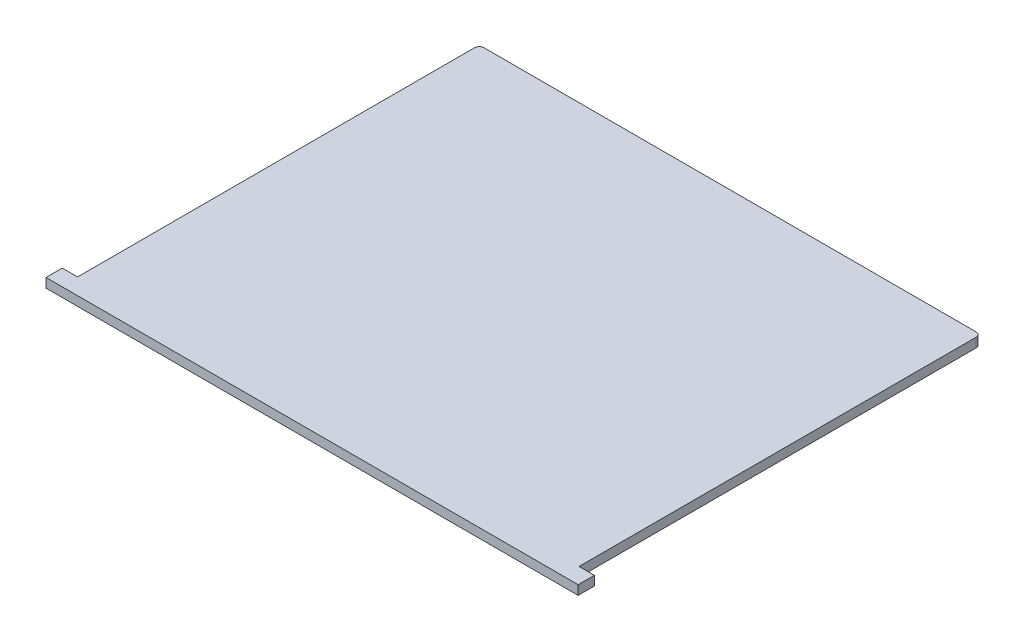
from build123d import *

# Parameters (mm, degrees)
BOSS_EXTRUDE1_DEPTH = 1
FILLET1_R           = 0.5


with BuildPart() as part:
    # Sketch1 → Boss-Extrude1 (new body)
    with BuildSketch(Plane(origin=(0, 0, 0), x_dir=(1, 0, 0), z_dir=(0, 1, 0))):
        Polygon((-27, -22.5), (27, -22.5), (28.65, -22.5), (28.65, -20.75), (27, -20.75), (27, 22.5), (-27, 22.5), (-27, -20.75), (-28.65, -20.75), (-28.65, -22.5), align=None)
    extrude(amount=BOSS_EXTRUDE1_DEPTH)

    # Fillet1
    fillet1_edges = [part.edges().sort_by_distance(p)[0] for p in [
        (27, 0.5, -22.5),
        (-27, 0.5, -22.5),
    ]]
    fillet(fillet1_edges, radius=FILLET1_R)


solid = part.part
